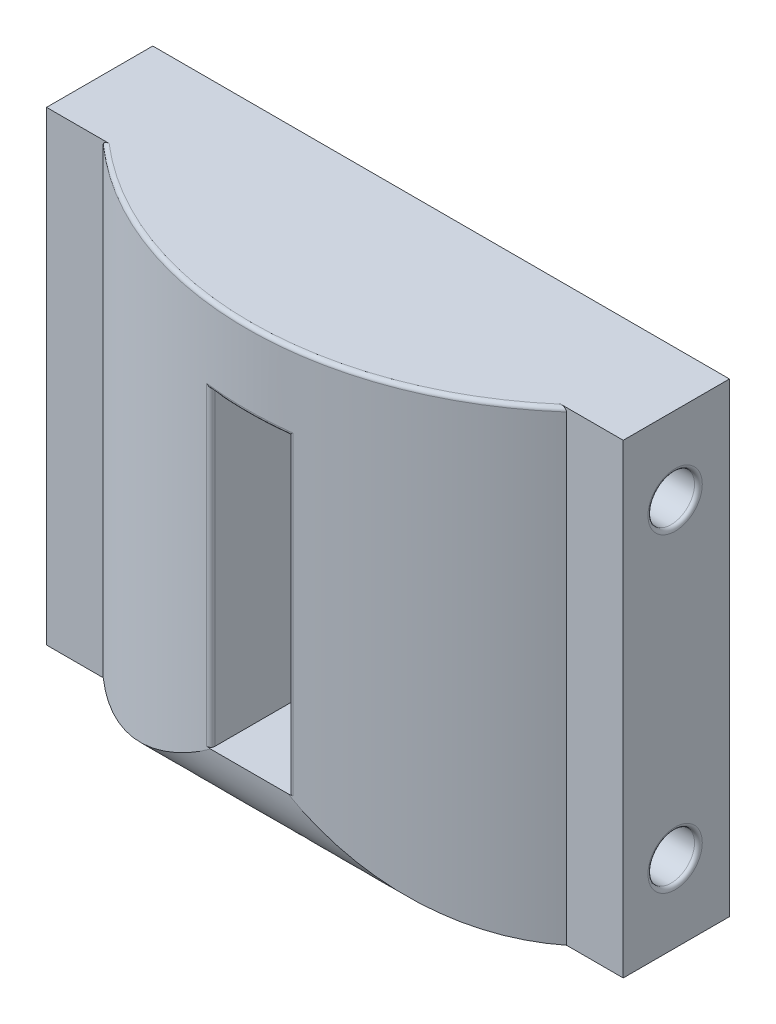
from build123d import *

# Parameters (mm, degrees)
SKETCH1_W               = 29.85
SKETCH1_H               = 30
BOSS_EXTRUDE1_DEPTH     = 12.5
SKETCH2_W               = 5
SKETCH2_H               = 20
CUT_EXTRUDE1_DEPTH      = 45.127910669
CUT_EXTRUDE3_DEPTH      = 45.127910669
CUT_EXTRUDE5_DEPTH      = 45.127910669
SKETCH8_W               = 6.842575397
SKETCH8_H               = 30
BOSS_EXTRUDE5_DEPTH     = 3.65
SKETCH9_W               = 6.842575397
SKETCH9_H               = 30
BOSS_EXTRUDE6_DEPTH     = 3.65
CUT_EXTRUDE7_DEPTH      = 47.674404212
CUT_EXTRUDE7_DEPTH_BACK = 47.674404212
SKETCH4_R               = 1.5
FILLET17_R              = 0.25
FILLET19_R              = 0.25


with BuildPart() as part:
    # Sketch1 → Boss-Extrude1 (new body)
    with BuildSketch(Plane.XY):
        with Locations((14.925, 15)):
            Rectangle(SKETCH1_W, SKETCH1_H)
    extrude(amount=BOSS_EXTRUDE1_DEPTH)

    # Sketch2 → Cut-Extrude1 (cut, through all)
    with BuildSketch(Plane.XY.offset(12.5)):
        with Locations((14.925, 15)):
            Rectangle(SKETCH2_W, SKETCH2_H)
    extrude(amount=-CUT_EXTRUDE1_DEPTH, mode=Mode.SUBTRACT)

    # Sketch5 → Cut-Extrude3 (cut, through all)
    with BuildSketch(Plane.XZ):
        with BuildLine():
            Line((0, 6.842575397), (-5.709638119, 18.35105476))
            Line((-5.709638119, 18.35105476), (14.925, 23.822049063))
            Line((14.925, 23.822049063), (34.386752026, 18.35105476))
            Line((34.386752026, 18.35105476), (29.85, 6.842575397))
            ThreePointArc((29.85, 6.842575397), (14.925, 12.5), (0, 6.842575397))
        make_face()
    extrude(amount=-CUT_EXTRUDE3_DEPTH, mode=Mode.SUBTRACT)

    # Sketch7 → Cut-Extrude5 (cut, through all)
    with BuildSketch(Plane(origin=(29.85, 0, 0), x_dir=(0, 0, -1), z_dir=(1, 0, 0))):
        with BuildLine():
            Line((-6.842575397, 0), (-6.842575397, -1.983675783))
            Line((-6.842575397, -1.983675783), (-14.601311023, -1.983675783))
            Line((-14.601311023, -1.983675783), (-14.601311023, 5))
            Line((-14.601311023, 5), (-12.360777707, 5))
            add(Edge.make_bspline(
                [(-6.842575397, 0), (-11.686120983, 0.298823628), (-12.360777707, 5)],
                knots=[0, 0, 0, 1, 1, 1], degree=2))
        make_face()
    extrude(amount=-CUT_EXTRUDE5_DEPTH, mode=Mode.SUBTRACT)

    # Sketch8 → Boss-Extrude5 (add)
    with BuildSketch(Plane(origin=(29.85, 0, 0), x_dir=(0, 0, -1), z_dir=(1, 0, 0))):
        with Locations((-3.421287699, 15)):
            Rectangle(SKETCH8_W, SKETCH8_H)
    extrude(amount=BOSS_EXTRUDE5_DEPTH)

    # Sketch9 → Boss-Extrude6 (add)
    with BuildSketch(Plane.ZY):
        with Locations((3.421287699, 15)):
            Rectangle(SKETCH9_W, SKETCH9_H)
    extrude(amount=BOSS_EXTRUDE6_DEPTH)

    # Sketch4 → Cut-Extrude7 (cut, two sides: drawn at the far end of the back side and taken through both)
    with BuildSketch(Plane(origin=(29.85, 0, 0), x_dir=(0, 0, -1), z_dir=(1, 0, 0)).offset(-CUT_EXTRUDE7_DEPTH_BACK)):
        with Locations((-3.5, 25)):
            Circle(SKETCH4_R)
        with Locations((-3.5, 5)):
            Circle(SKETCH4_R)
    extrude(amount=CUT_EXTRUDE7_DEPTH + CUT_EXTRUDE7_DEPTH_BACK, mode=Mode.SUBTRACT)

    # Fillet17
    fillet17_edges = [part.edges().sort_by_distance(p)[0] for p in [
        (-3.65, 25, 5),
        (33.5, 25, 5),
        (-3.65, 5, 5),
        (33.5, 5, 5),
    ]]
    fillet(fillet17_edges, radius=FILLET17_R)

    # Fillet19
    # the kernel refuses this fillet: 0.25 mm, written as the material it takes off along each edge
    with BuildSketch(Plane(origin=(17.425, 25, 12.360777707), x_dir=(0.9930996963041147, 0, -0.11727315635163624), z_dir=(0, -1, 0))) as fillet19_piece_1:
        with BuildLine():
            CenterArc((0.28125848, -0.249995069), FILLET19_R, 89.640140573, 97.094614091)
            Line((0.032983556, -0.279313358), (0, 0))
            ThreePointArc((0, 0), (0.141414326, 0.000444094), (0.282828652, 0))
        make_face()
    extrude(amount=20, mode=Mode.SUBTRACT)
    with BuildSketch(Plane(origin=(14.925, 25, -10.015728977), x_dir=(-0.13857412950442824, 0, 0.9903520639813349), z_dir=(-0.9903520639813349, 0, -0.13857412950442824))) as fillet19_piece_2_section:
        with BuildLine():
            CenterArc((22.515728977 - FILLET19_R, FILLET19_R), FILLET19_R, 270, 90)
            Line((22.515728977 - FILLET19_R, 0), (22.515728977, 0))
            Line((22.515728977, 0), (22.515728977, FILLET19_R))
        make_face()
    fillet19_piece_2 = revolve(axis=Axis((14.925, 25, -10.015728977), (0, 1, 0)), revolution_arc=15.930691333, mode=Mode.PRIVATE)
    fillet19_piece_2 = split(fillet19_piece_2, bisect_by=Plane(origin=(12.425, 25.070178335, 12.429821665), z_dir=(1, 0, 0)), keep=Keep.TOP, mode=Mode.PRIVATE)
    fillet19_piece_2 = split(fillet19_piece_2, bisect_by=Plane(origin=(17.425, 25.070178335, 12.429821665), z_dir=(-1, 0, 0)), keep=Keep.TOP, mode=Mode.PRIVATE)
    add(fillet19_piece_2, mode=Mode.SUBTRACT)
    with BuildSketch(Plane(origin=(14.925, 30, -10.015728977), x_dir=(0.6834024940823613, 0, 0.7300418009141724), z_dir=(0.7300418009141724, 0, -0.6834024940823613))) as fillet19_piece_3_section:
        with BuildLine():
            CenterArc((22.515728977 - FILLET19_R, FILLET19_R), FILLET19_R, 270, 90)
            Line((22.515728977, FILLET19_R), (22.515728977, 0))
            Line((22.515728977, 0), (22.515728977 - FILLET19_R, 0))
        make_face()
    fillet19_piece_3 = revolve(axis=Axis((14.925, 30, -10.015728977), (0, -1, 0)), revolution_arc=86.220203027, mode=Mode.PRIVATE)
    fillet19_piece_3 = split(fillet19_piece_3, bisect_by=Plane(origin=(14.925, 29.93245071, 6.842575397), z_dir=(0, 0, 1)), keep=Keep.TOP, mode=Mode.PRIVATE)
    add(fillet19_piece_3, mode=Mode.SUBTRACT)
    with BuildSketch(Plane(origin=(12.425, 25, 12.360777707), x_dir=(-0.9930996963041147, 0, -0.1172731563516355), z_dir=(0, -1, 0))) as fillet19_piece_4:
        with BuildLine():
            CenterArc((0.28125848, 0.249995069), FILLET19_R, 173.265245336, 97.094614091)
            Line((0.032983556, 0.279313358), (0, 0))
            ThreePointArc((0, 0), (0.141414326, -0.000444094), (0.282828652, 0))
        make_face()
    extrude(amount=20, mode=Mode.SUBTRACT)
    with BuildSketch(Plane(origin=(17.425, 25.707071631, 12.360777707), x_dir=(0.9930996963041131, 0, -0.11727315635164862), z_dir=(0, -1, 0))) as fillet19_piece_5a_section:
        with BuildLine():
            CenterArc((0.28125848, -0.249995069), FILLET19_R, 89.640140573, 97.094614091)
            Line((0.032983556, -0.279313358), (0, 0))
            ThreePointArc((0, 0), (0.141414326, 0.000444094), (0.282828652, 0))
        make_face()
    fillet19_piece_5a = extrude(amount=20.707071631, mode=Mode.PRIVATE)
    fillet19_piece_5a = split(fillet19_piece_5a, bisect_by=Plane(origin=(17.489598012, 25, 12.288810309), z_dir=(0, 1, 0)), keep=Keep.TOP, mode=Mode.PRIVATE)
    with BuildSketch(Plane(origin=(14.925, 25, -10.015728977), x_dir=(-0.13857412950442824, 0, 0.9903520639813349), z_dir=(-0.9903520639813349, 0, -0.13857412950442824))) as fillet19_piece_5b_section:
        with BuildLine():
            CenterArc((22.515728977 - FILLET19_R, FILLET19_R), FILLET19_R, 270, 90)
            Line((22.515728977 - FILLET19_R, 0), (22.515728977, 0))
            Line((22.515728977, 0), (22.515728977, FILLET19_R))
        make_face()
    fillet19_piece_5b = revolve(axis=Axis((14.925, 25, -10.015728977), (0, 1, 0)), revolution_arc=15.930691333, mode=Mode.PRIVATE)
    fillet19_piece_5b = split(fillet19_piece_5b, bisect_by=Plane(origin=(17.425, 25.056986655, 12.26732893), z_dir=(1, 0, 0)), keep=Keep.TOP, mode=Mode.PRIVATE)
    fillet19_piece_5 = fillet19_piece_5a & fillet19_piece_5b
    add(fillet19_piece_5, mode=Mode.SUBTRACT)
    with BuildSketch(Plane(origin=(14.925, 25, -10.015728977), x_dir=(-0.13857412950442824, 0, 0.9903520639813349), z_dir=(-0.9903520639813349, 0, -0.13857412950442824))) as fillet19_piece_6a_section:
        with BuildLine():
            CenterArc((22.515728977 - FILLET19_R, FILLET19_R), FILLET19_R, 270, 90)
            Line((22.515728977 - FILLET19_R, 0), (22.515728977, 0))
            Line((22.515728977, 0), (22.515728977, FILLET19_R))
        make_face()
    fillet19_piece_6a = revolve(axis=Axis((14.925, 25, -10.015728977), (0, 1, 0)), revolution_arc=15.930691333, mode=Mode.PRIVATE)
    fillet19_piece_6a = split(fillet19_piece_6a, bisect_by=Plane(origin=(12.425, 25.056986602, 12.267328652), z_dir=(-1, 0, 0)), keep=Keep.TOP, mode=Mode.PRIVATE)
    with BuildSketch(Plane(origin=(12.425, 25.707071631, 12.360777707), x_dir=(-0.9930996963041131, 0, -0.11727315635164788), z_dir=(0, -1, 0))) as fillet19_piece_6b_section:
        with BuildLine():
            CenterArc((0.28125848, 0.249995069), FILLET19_R, 173.265245336, 97.094614091)
            Line((0.032983556, 0.279313358), (0, 0))
            ThreePointArc((0, 0), (0.141414326, -0.000444094), (0.282828652, 0))
        make_face()
    fillet19_piece_6b = extrude(amount=20.707071631, mode=Mode.PRIVATE)
    fillet19_piece_6b = split(fillet19_piece_6b, bisect_by=Plane(origin=(12.360401988, 25, 12.288810309), z_dir=(0, 1, 0)), keep=Keep.TOP, mode=Mode.PRIVATE)
    fillet19_piece_6 = fillet19_piece_6a & fillet19_piece_6b
    add(fillet19_piece_6, mode=Mode.SUBTRACT)


solid = part.part
